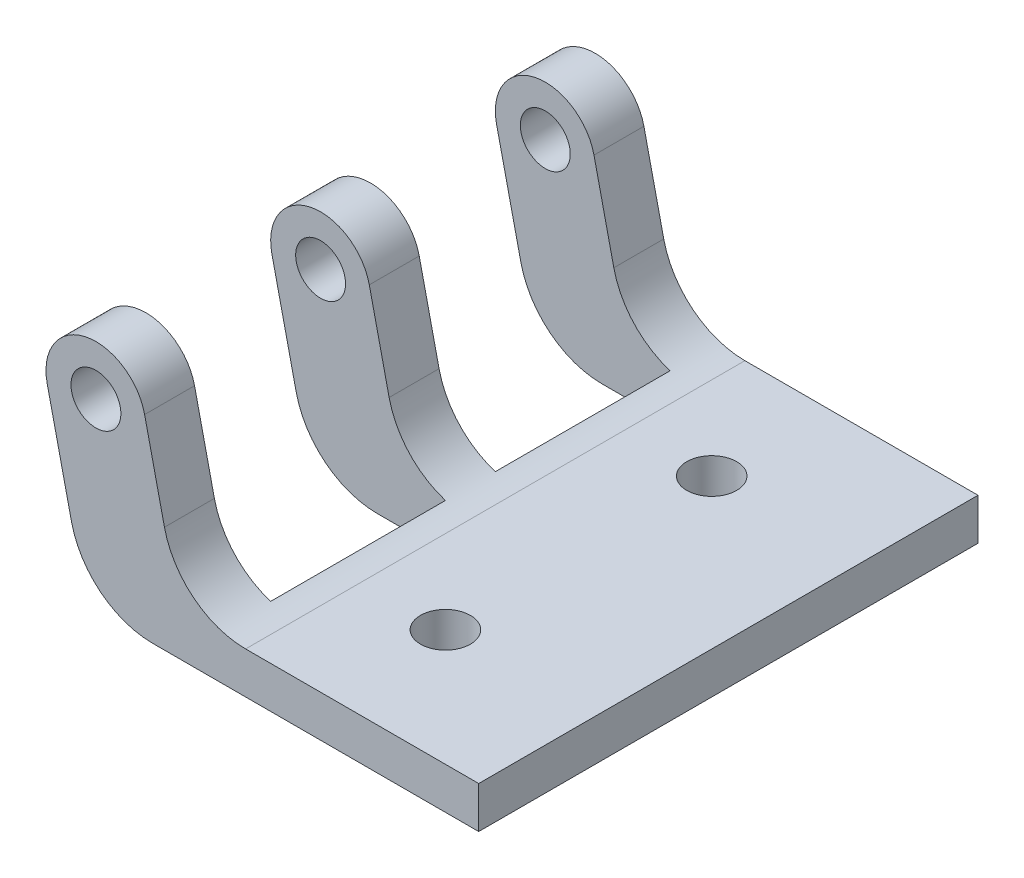
from build123d import *

# Parameters (mm, degrees)
ESBO_O1_R                  = 1.5
RESSALTO_EXTRUS_O1_DEPTH   = 30
FILETE1_R                  = 5
CORTE_EXTRUS_O1_DEPTH      = 37.349002737
CORTE_EXTRUS_O1_DEPTH_BACK = 37.349002737
ESBO_O2_R                  = 1.5
ESBO_O2_W                  = 10.5
ESBO_O2_H                  = 10.5


with BuildPart() as part:
    # Esboço1 → Ressalto-extrusão1 (new body)
    with BuildSketch(Plane.XY):
        with BuildLine():
            Line((-9, 0), (9, 0))
            Line((9, 0), (9, -2.5))
            Line((9, -2.5), (-14.585891007, -2.5))
            Line((-14.585891007, -2.5), (-16.925971737, 7.837663684))
            ThreePointArc((-16.925971737, 7.837663684), (-14.662336316, 11.425971737), (-11.074028263, 9.162336316))
            Line((-11.074028263, 9.162336316), (-9, 0))
        make_face()
        with Locations((-14, 8.5)):
            Circle(ESBO_O1_R, mode=Mode.SUBTRACT)
    extrude(amount=RESSALTO_EXTRUS_O1_DEPTH)

    # Filete1
    filete1_edges = [part.edges().sort_by_distance(p)[0] for p in [
        (-14.585891007, -2.5, 15),
        (-9, 0, 15),
    ]]
    fillet(filete1_edges, radius=FILETE1_R)

    # Esboço2 → Corte-extrusão1 (cut, two sides: drawn at the far end of the back side and taken through both)
    with BuildSketch(Plane(origin=(0, 0, 0), x_dir=(1, 0, 0), z_dir=(0, 1, 0)).offset(-CORTE_EXTRUS_O1_DEPTH_BACK)):
        with Locations((0, -7)):
            Circle(ESBO_O2_R)
        with Locations((0, -23)):
            Circle(ESBO_O2_R)
        with Locations((-11.75, -8.25)):
            Rectangle(ESBO_O2_W, ESBO_O2_H)
        with Locations((-11.75, -21.75)):
            Rectangle(ESBO_O2_W, ESBO_O2_H)
    extrude(amount=CORTE_EXTRUS_O1_DEPTH + CORTE_EXTRUS_O1_DEPTH_BACK, mode=Mode.SUBTRACT)


solid = part.part
